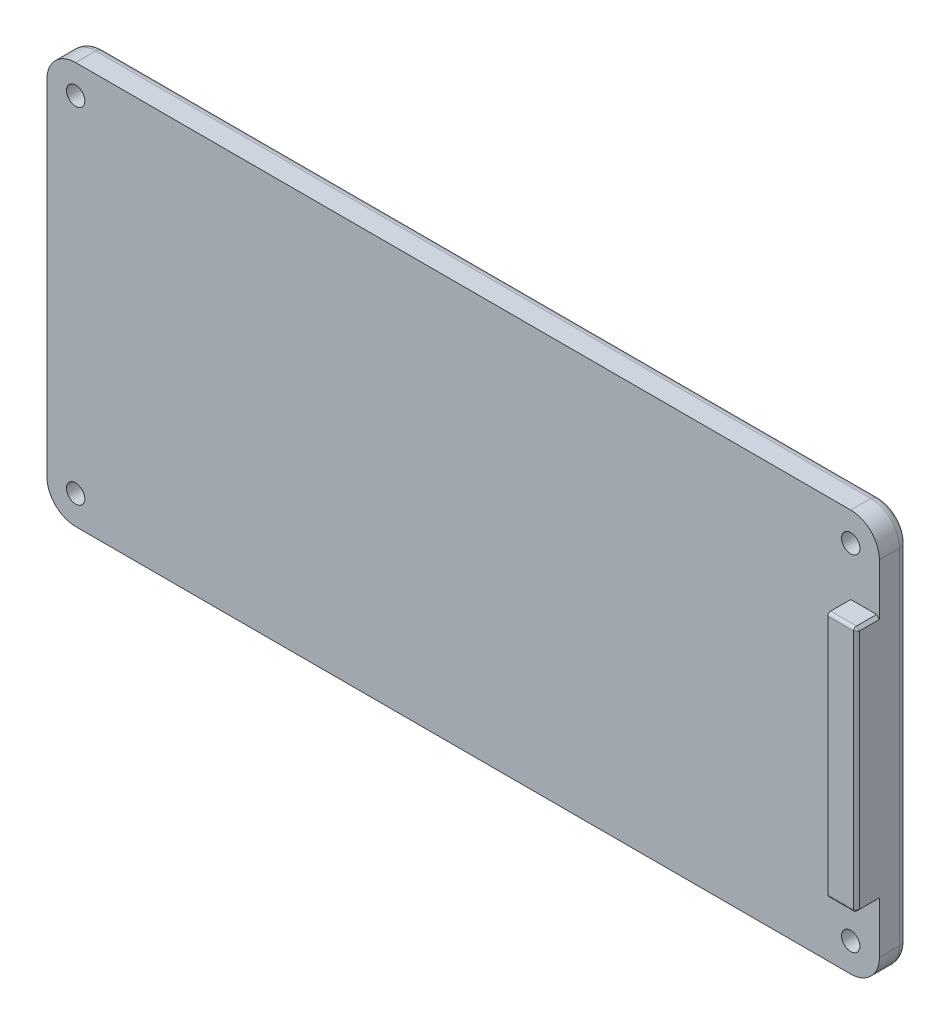
from build123d import *

# Parameters (mm, degrees)
SKIZZE1_W                                    = 145
SKIZZE1_H                                    = 70
AUFSATZ_LINEAR_AUSTRAGEN1_DEPTH              = 5
VERRUNDUNG1_R                                = 5
FORMSENKUNG_F_R_M3_LINSENSENKSCHRAUB_2_COUNT = 2
FORMSENKUNG_F_R_M3_LINSENSENKSCHRAUB_2_PITCH = 60
FORMSENKUNG_F_R_M3_LINSENSENKSCHRAUB_3_COUNT = 2
FORMSENKUNG_F_R_M3_LINSENSENKSCHRAUB_3_PITCH = 135
FORMSENKUNG_F_R_M3_LINSENSENKSCHRAUB_4_COUNT = 2
FORMSENKUNG_F_R_M3_LINSENSENKSCHRAUB_4_PITCH = 147.732867027
SKIZZE5_W                                    = 5
SKIZZE5_H                                    = 43
AUFSATZ_LINEAR_AUSTRAGEN2_DEPTH              = 4
VERRUNDUNG2_R                                = 0.5
FASE1_SIZE                                   = 0.5
VERRUNDUNG3_R                                = 1.5


with BuildPart() as part:
    # Skizze1 → Aufsatz-Linear austragen1 (new body)
    with BuildSketch(Plane.XY):
        Rectangle(SKIZZE1_W, SKIZZE1_H)
    extrude(amount=AUFSATZ_LINEAR_AUSTRAGEN1_DEPTH)

    # Verrundung1
    verrundung1_edges = [part.edges().sort_by_distance(p)[0] for p in [
        (72.5, -35, 2.5),
        (-72.5, -35, 2.5),
        (-72.5, 35, 2.5),
        (72.5, 35, 2.5),
    ]]
    fillet(verrundung1_edges, radius=VERRUNDUNG1_R)

    # Skizze4 → Formsenkung für M3 Linsensenkschraube mit Schlitz1 (revolve, cut)
    with BuildSketch(Plane(origin=(67.5, 30, 0), x_dir=(0, 1, 0), z_dir=(1, 0, 0))):
        Polygon((0, 0), (0, 5), (1.6, 5), (1.6, 2.55), (3.15, 1), (3.15, 0), align=None)
    formsenkung_f_r_m3_linsensenkschraube_mi = revolve(axis=Axis((67.5, 30, -6.35), (0, 0, 1)), mode=Mode.SUBTRACT)

    # Formsenkung f_r M3 Linsensenkschraub 2: Formsenkung für M3 Linsensenkschraube mit Schlitz1 ×2
    with Locations(*[(0, -i * FORMSENKUNG_F_R_M3_LINSENSENKSCHRAUB_2_PITCH, 0) for i in range(1, FORMSENKUNG_F_R_M3_LINSENSENKSCHRAUB_2_COUNT)]):
        add(formsenkung_f_r_m3_linsensenkschraube_mi, mode=Mode.SUBTRACT)

    # Formsenkung f_r M3 Linsensenkschraub 3: Formsenkung für M3 Linsensenkschraube mit Schlitz1 ×2
    with Locations(*[(-i * FORMSENKUNG_F_R_M3_LINSENSENKSCHRAUB_3_PITCH, 0, 0) for i in range(1, FORMSENKUNG_F_R_M3_LINSENSENKSCHRAUB_3_COUNT)]):
        add(formsenkung_f_r_m3_linsensenkschraube_mi, mode=Mode.SUBTRACT)

    # Formsenkung f_r M3 Linsensenkschraub 4: Formsenkung für M3 Linsensenkschraube mit Schlitz1 ×2
    with Locations(*[Vector(-0.9138115486202572, -0.4061384660534477, 0) * (i * FORMSENKUNG_F_R_M3_LINSENSENKSCHRAUB_4_PITCH) for i in range(1, FORMSENKUNG_F_R_M3_LINSENSENKSCHRAUB_4_COUNT)]):
        add(formsenkung_f_r_m3_linsensenkschraube_mi, mode=Mode.SUBTRACT)

    # Skizze5 → Aufsatz-Linear austragen2 (add)
    with BuildSketch(Plane.XY.offset(5)):
        with Locations((70, 0)):
            Rectangle(SKIZZE5_W, SKIZZE5_H)
    extrude(amount=AUFSATZ_LINEAR_AUSTRAGEN2_DEPTH)

    # Verrundung2
    verrundung2_edges = [part.edges().sort_by_distance(p)[0] for p in [
        (70, 21.5, 9),
        (70, -21.5, 9),
    ]]
    fillet(verrundung2_edges, radius=VERRUNDUNG2_R)

    # Fase1
    fase1_edges = [part.edges().sort_by_distance(p)[0] for p in [
        (72.5, 0, 9),
        (72.5, 21.5, 6.75),
        (72.5, -21.5, 6.75),
        (72.5, 21.353553391, 8.853553391),
        (72.5, -21.353553391, 8.853553391),
    ]]
    chamfer(fase1_edges, length=FASE1_SIZE - 0.0001)  # a hair under: the kernel refuses the full size

    # Verrundung3
    verrundung3_edges = [part.edges().sort_by_distance(p)[0] for p in [
        (72.5, 0, 0),
        (0, -35, 0),
        (-72.5, 0, 0),
        (0, 35, 0),
        (-71.035533906, 33.535533906, 0),
        (71.035533906, 33.535533906, 0),
        (-71.035533906, -33.535533906, 0),
        (71.035533906, -33.535533906, 0),
    ]]
    fillet(verrundung3_edges, radius=VERRUNDUNG3_R)


solid = part.part
